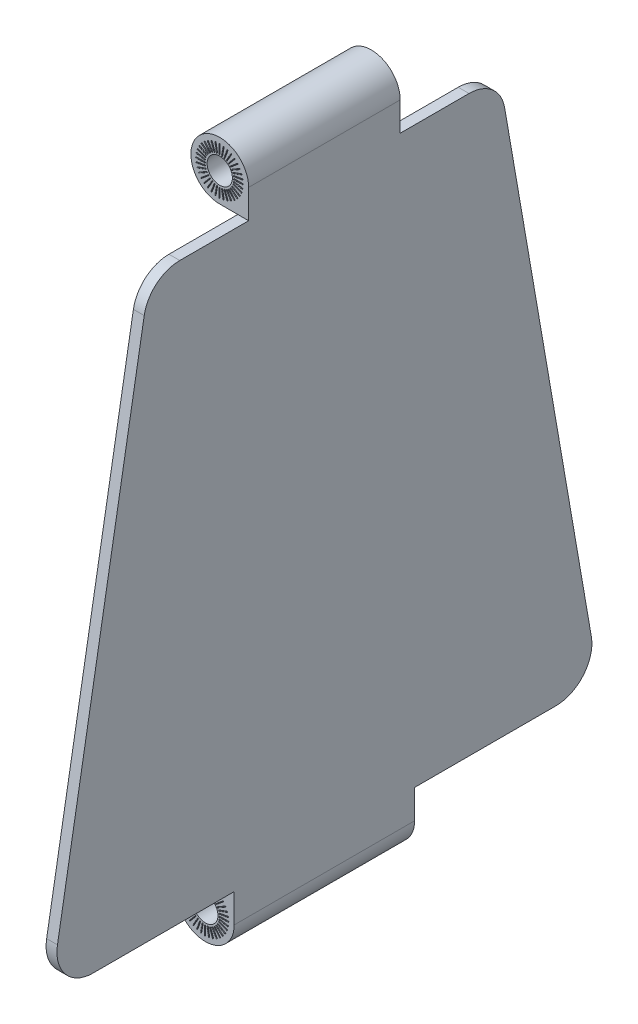
from build123d import *

# Parameters (mm, degrees)
BOSS_EXTRUDE1_DEPTH      = 76
BOSS_EXTRUDE1_DEPTH_BACK = 76
SKETCH1_R                = 8
SKETCH2_W                = 174.348396913
SKETCH2_H                = 36.623330016
SKETCH2_W_2              = 158.861261105
SKETCH2_H_2              = 40.351297492
CUT_EXTRUDE1_DEPTH       = 199.798893357
SKETCH3_W                = 238.196848014
SKETCH3_H                = 22.562128098
SKETCH3_W_2              = 145.719761373
CUT_EXTRUDE2_DEPTH       = 199.798893357
CUT_EXTRUDE3_DEPTH       = 199.798893357
FILLET1_R                = 10
FILLET2_R                = 10
CUT_EXTRUDE4_DEPTH       = 199.088533134
CUT_EXTRUDE4_DEPTH_BACK  = 199.088533134
SKETCH6_R                = 3.5
SKETCH7_W                = 0.2
SKETCH7_H                = 2.5
BOSS_EXTRUDE2_DEPTH      = 21.2
FILLET3_R                = 0.1
CIRPATTERN2_COUNT        = 36
FILLET3_OF_CIRPATTERN2_R = 0.1
SKETCH8_W                = 0.2
SKETCH8_H                = 2.5
BOSS_EXTRUDE3_DEPTH      = 25.2
FILLET4_R                = 0.1
CIRPATTERN9_START        = -6.5
CIRPATTERN9_DEPTH        = 2.5
CIRPATTERN9_START_2      = -14.5
CIRPATTERN9_2_DEPTH      = 2.5
CIRPATTERN9_START_3      = -4
CIRPATTERN9_3_DEPTH      = 2.5
CIRPATTERN9_START_4      = -7.889185421
CIRPATTERN9_4_DEPTH      = 2.5
CIRPATTERN9_START_5      = 2.610814579
CIRPATTERN9_5_DEPTH      = 2.5
CIRPATTERN9_START_6      = -9.236161147
CIRPATTERN9_6_DEPTH      = 2.5
CIRPATTERN9_START_7      = 1.263838853
CIRPATTERN9_7_DEPTH      = 2.5
CIRPATTERN9_START_8      = -10.5
CIRPATTERN9_8_DEPTH      = 2.5
CIRPATTERN9_9_DEPTH      = 2.5
CIRPATTERN9_START_9      = -11.642300877
CIRPATTERN9_10_DEPTH     = 2.5
CIRPATTERN9_START_10     = -1.142300877
CIRPATTERN9_11_DEPTH     = 2.5
CIRPATTERN9_START_11     = -12.628355545
CIRPATTERN9_12_DEPTH     = 2.5
CIRPATTERN9_START_12     = -2.128355545
CIRPATTERN9_13_DEPTH     = 2.5
CIRPATTERN9_START_13     = -13.42820323
CIRPATTERN9_14_DEPTH     = 2.5
CIRPATTERN9_START_14     = -2.92820323
CIRPATTERN9_15_DEPTH     = 2.5
CIRPATTERN9_START_15     = -14.017540966
CIRPATTERN9_16_DEPTH     = 2.5
CIRPATTERN9_START_16     = -3.517540966
CIRPATTERN9_17_DEPTH     = 2.5
CIRPATTERN9_START_17     = -14.378462024
CIRPATTERN9_18_DEPTH     = 2.5
CIRPATTERN9_START_18     = -3.878462024
CIRPATTERN9_19_DEPTH     = 2.5
CIRPATTERN9_20_DEPTH     = 2.5
CIRPATTERN9_21_DEPTH     = 2.5
CIRPATTERN9_22_DEPTH     = 2.5
CIRPATTERN9_23_DEPTH     = 2.5
CIRPATTERN9_24_DEPTH     = 2.5
CIRPATTERN9_25_DEPTH     = 2.5
CIRPATTERN9_26_DEPTH     = 2.5
CIRPATTERN9_27_DEPTH     = 2.5
CIRPATTERN9_28_DEPTH     = 2.5
CIRPATTERN9_29_DEPTH     = 2.5
CIRPATTERN9_30_DEPTH     = 2.5
CIRPATTERN9_31_DEPTH     = 2.5
CIRPATTERN9_32_DEPTH     = 2.5
CIRPATTERN9_33_DEPTH     = 2.5
CIRPATTERN9_34_DEPTH     = 2.5
CIRPATTERN9_35_DEPTH     = 2.5


with BuildPart() as part:
    # Sketch1 → Boss-Extrude1 (new, two sides: drawn at the far end of the back side and taken through both)
    with BuildSketch(Plane.XY.offset(-BOSS_EXTRUDE1_DEPTH_BACK)):
        with Locations((-8, 175)):
            Circle(SKETCH1_R)
        with BuildLine():
            ThreePointArc((-3, 168.755002002), (-5.350470229, 167.451490744), (-8, 167))
            Line((-8, 167), (-3, 167))
            Line((-3, 167), (-3, 168.755002002))
        make_face()
        with BuildLine():
            ThreePointArc((-3, 6.244997998), (-0.788897449, 3.464101615), (0, 0))
            Line((0, 0), (0, 175))
            ThreePointArc((0, 175), (-0.788897449, 171.535898385), (-3, 168.755002002))
            Line((-3, 168.755002002), (-3, 167))
            Line((-3, 167), (-3, 8))
            Line((-3, 8), (-3, 6.244997998))
        make_face()
        with BuildLine():
            ThreePointArc((-8, 8), (-5.350470229, 7.548509256), (-3, 6.244997998))
            Line((-3, 6.244997998), (-3, 8))
            Line((-3, 8), (-8, 8))
        make_face()
        with Locations((-8, 0)):
            Circle(SKETCH1_R)
    extrude(amount=BOSS_EXTRUDE1_DEPTH + BOSS_EXTRUDE1_DEPTH_BACK)

    # Sketch2 → Cut-Extrude1 (cut, through all)
    with BuildSketch(Plane(origin=(0, 0, 0), x_dir=(0, 0, -1), z_dir=(1, 0, 0))):
        with Locations((108.174198457, 185.311665008)):
            Rectangle(SKETCH2_W, SKETCH2_H)
        with Locations((-100.430630553, 187.175648746)):
            Rectangle(SKETCH2_W_2, SKETCH2_H_2)
    extrude(amount=-CUT_EXTRUDE1_DEPTH, mode=Mode.SUBTRACT)

    # Sketch3 → Cut-Extrude2 (cut, through all)
    with BuildSketch(Plane(origin=(0, 0, 0), x_dir=(0, 0, -1), z_dir=(1, 0, 0))):
        with Locations((-144.098424007, -3.281064049)):
            Rectangle(SKETCH3_W, SKETCH3_H)
        with Locations((97.859880687, -3.281064049)):
            Rectangle(SKETCH3_W_2, SKETCH3_H)
    extrude(amount=-CUT_EXTRUDE2_DEPTH, mode=Mode.SUBTRACT)

    # Sketch4 → Cut-Extrude3 (cut, through all)
    with BuildSketch(Plane(origin=(0, 0, 0), x_dir=(0, 0, -1), z_dir=(1, 0, 0))):
        Polygon((48.5, 167), (48.5, 180.668387229), (93.570436927, 180.668387229), (93.570436927, 2.807353777), (76, 2.807353777), (76, 8), align=None)
        Polygon((-48.5, 167), (-76, 8), (-76, 0), (-100.934074168, 0), (-100.934074168, 184.48155451), (-48.5, 184.48155451), align=None)
    extrude(amount=-CUT_EXTRUDE3_DEPTH, mode=Mode.SUBTRACT)

    # Fillet1
    fillet1_edges = [part.edges().sort_by_distance(p)[0] for p in [
        (-1.5, 167, -48.5),
        (-1.5, 167, 48.5),
    ]]
    fillet(fillet1_edges, radius=FILLET1_R)

    # Fillet2
    fillet2_edges = [part.edges().sort_by_distance(p)[0] for p in [
        (-1.5, 8, 76),
        (-1.5, 8, -76),
    ]]
    fillet(fillet2_edges, radius=FILLET2_R)

    # Sketch6 → Cut-Extrude4 (cut, two sides: drawn at the far end of the back side and taken through both)
    with BuildSketch(Plane.XY.offset(-CUT_EXTRUDE4_DEPTH_BACK)):
        with Locations((-8, 175)):
            Circle(SKETCH6_R)
        with Locations(Location((-8, 0, 0), (0, 0, 90))):
            Circle(SKETCH6_R)
    extrude(amount=CUT_EXTRUDE4_DEPTH + CUT_EXTRUDE4_DEPTH_BACK, mode=Mode.SUBTRACT)

    # Sketch7 → Boss-Extrude2 (add, symmetric)
    with BuildSketch(Plane.XY):
        with Locations((-8, 180.25)):
            Rectangle(SKETCH7_W, SKETCH7_H)
    boss_extrude2 = extrude(amount=BOSS_EXTRUDE2_DEPTH, both=True)

    # Fillet3
    fillet3_edges = [part.edges().sort_by_distance(p)[0] for p in [
        (-8.1, 180.25, 21.2),
        (-7.9, 180.25, 21.2),
        (-8.1, 180.25, -21.2),
        (-7.9, 180.25, -21.2),
    ]]
    fillet(fillet3_edges, radius=FILLET3_R - 0.0001)  # a hair under: the kernel refuses the full size

    # CirPattern2: Boss-Extrude2 ×36 about axis
    cirpattern2_axis = Axis((-8, 175, 0), (0, 0, 1))
    for i in range(1, CIRPATTERN2_COUNT):
        add(boss_extrude2.rotate(cirpattern2_axis, i * 360 / CIRPATTERN2_COUNT))

    # Fillet3 of CirPattern2
    fillet3_of_cirpattern2_edges = [part.edges().sort_by_distance(p)[0] for p in [
        (-9.010133708, 180.152875886, 21.2),
        (-8.813172157, 180.187605521, 21.2),
        (-9.010133708, 180.152875886, -21.2),
        (-8.813172157, 180.187605521, -21.2),
        (-9.889575015, 179.899184245, 21.2),
        (-9.70163649, 179.967588273, 21.2),
        (-9.889575015, 179.899184245, -21.2),
        (-9.70163649, 179.967588273, -21.2),
        (-10.71160254, 179.49663337, 21.2),
        (-10.53839746, 179.59663337, 21.2),
        (-10.71160254, 179.49663337, -21.2),
        (-10.53839746, 179.59663337, -21.2),
        (-11.451239395, 178.957454565, 21.2),
        (-11.298030507, 179.086012087, 21.2),
        (-11.451239395, 178.957454565, -21.2),
        (-11.298030507, 179.086012087, -21.2),
        (-12.086012087, 178.298030507, 21.2),
        (-11.957454565, 178.451239395, 21.2),
        (-12.086012087, 178.298030507, -21.2),
        (-11.957454565, 178.451239395, -21.2),
        (-12.59663337, 177.53839746, 21.2),
        (-12.49663337, 177.71160254, 21.2),
        (-12.59663337, 177.53839746, -21.2),
        (-12.49663337, 177.71160254, -21.2),
        (-12.967588273, 176.70163649, 21.2),
        (-12.899184245, 176.889575015, 21.2),
        (-12.967588273, 176.70163649, -21.2),
        (-12.899184245, 176.889575015, -21.2),
        (-13.187605521, 175.813172157, 21.2),
        (-13.152875886, 176.010133708, 21.2),
        (-13.187605521, 175.813172157, -21.2),
        (-13.152875886, 176.010133708, -21.2),
        (-13.25, 174.9, 21.2),
        (-13.25, 175.1, 21.2),
        (-13.25, 174.9, -21.2),
        (-13.25, 175.1, -21.2),
        (-13.152875886, 173.989866292, 21.2),
        (-13.187605521, 174.186827843, 21.2),
        (-13.152875886, 173.989866292, -21.2),
        (-13.187605521, 174.186827843, -21.2),
        (-12.899184245, 173.110424985, 21.2),
        (-12.967588273, 173.29836351, 21.2),
        (-12.899184245, 173.110424985, -21.2),
        (-12.967588273, 173.29836351, -21.2),
        (-12.49663337, 172.28839746, 21.2),
        (-12.59663337, 172.46160254, 21.2),
        (-12.49663337, 172.28839746, -21.2),
        (-12.59663337, 172.46160254, -21.2),
        (-11.957454565, 171.548760605, 21.2),
        (-12.086012087, 171.701969493, 21.2),
        (-11.957454565, 171.548760605, -21.2),
        (-12.086012087, 171.701969493, -21.2),
        (-11.298030507, 170.913987913, 21.2),
        (-11.451239395, 171.042545435, 21.2),
        (-11.298030507, 170.913987913, -21.2),
        (-11.451239395, 171.042545435, -21.2),
        (-10.53839746, 170.40336663, 21.2),
        (-10.71160254, 170.50336663, 21.2),
        (-10.53839746, 170.40336663, -21.2),
        (-10.71160254, 170.50336663, -21.2),
        (-9.70163649, 170.032411727, 21.2),
        (-9.889575015, 170.100815755, 21.2),
        (-9.70163649, 170.032411727, -21.2),
        (-9.889575015, 170.100815755, -21.2),
        (-8.813172157, 169.812394479, 21.2),
        (-9.010133708, 169.847124114, 21.2),
        (-8.813172157, 169.812394479, -21.2),
        (-9.010133708, 169.847124114, -21.2),
        (-7.9, 169.75, 21.2),
        (-8.1, 169.75, 21.2),
        (-7.9, 169.75, -21.2),
        (-8.1, 169.75, -21.2),
        (-6.989866292, 169.847124114, 21.2),
        (-7.186827843, 169.812394479, 21.2),
        (-6.989866292, 169.847124114, -21.2),
        (-7.186827843, 169.812394479, -21.2),
        (-6.110424985, 170.100815755, 21.2),
        (-6.29836351, 170.032411727, 21.2),
        (-6.110424985, 170.100815755, -21.2),
        (-6.29836351, 170.032411727, -21.2),
        (-5.28839746, 170.50336663, 21.2),
        (-5.46160254, 170.40336663, 21.2),
        (-5.28839746, 170.50336663, -21.2),
        (-5.46160254, 170.40336663, -21.2),
        (-4.548760605, 171.042545435, 21.2),
        (-4.701969493, 170.913987913, 21.2),
        (-4.548760605, 171.042545435, -21.2),
        (-4.701969493, 170.913987913, -21.2),
        (-3.913987913, 171.701969493, 21.2),
        (-4.042545435, 171.548760605, 21.2),
        (-3.913987913, 171.701969493, -21.2),
        (-4.042545435, 171.548760605, -21.2),
        (-3.40336663, 172.46160254, 21.2),
        (-3.50336663, 172.28839746, 21.2),
        (-3.40336663, 172.46160254, -21.2),
        (-3.50336663, 172.28839746, -21.2),
        (-3.032411727, 173.29836351, 21.2),
        (-3.100815755, 173.110424985, 21.2),
        (-3.032411727, 173.29836351, -21.2),
        (-3.100815755, 173.110424985, -21.2),
        (-2.812394479, 174.186827843, 21.2),
        (-2.847124114, 173.989866292, 21.2),
        (-2.812394479, 174.186827843, -21.2),
        (-2.847124114, 173.989866292, -21.2),
        (-2.75, 175.1, 21.2),
        (-2.75, 174.9, 21.2),
        (-2.75, 175.1, -21.2),
        (-2.75, 174.9, -21.2),
        (-2.847124114, 176.010133708, 21.2),
        (-2.812394479, 175.813172157, 21.2),
        (-2.847124114, 176.010133708, -21.2),
        (-2.812394479, 175.813172157, -21.2),
        (-3.100815755, 176.889575015, 21.2),
        (-3.032411727, 176.70163649, 21.2),
        (-3.100815755, 176.889575015, -21.2),
        (-3.032411727, 176.70163649, -21.2),
        (-3.50336663, 177.71160254, 21.2),
        (-3.40336663, 177.53839746, 21.2),
        (-3.50336663, 177.71160254, -21.2),
        (-3.40336663, 177.53839746, -21.2),
        (-4.042545435, 178.451239395, 21.2),
        (-3.913987913, 178.298030507, 21.2),
        (-4.042545435, 178.451239395, -21.2),
        (-3.913987913, 178.298030507, -21.2),
        (-4.701969493, 179.086012087, 21.2),
        (-4.548760605, 178.957454565, 21.2),
        (-4.701969493, 179.086012087, -21.2),
        (-4.548760605, 178.957454565, -21.2),
        (-5.46160254, 179.59663337, 21.2),
        (-5.28839746, 179.49663337, 21.2),
        (-5.46160254, 179.59663337, -21.2),
        (-5.28839746, 179.49663337, -21.2),
        (-6.29836351, 179.967588273, 21.2),
        (-6.110424985, 179.899184245, 21.2),
        (-6.29836351, 179.967588273, -21.2),
        (-6.110424985, 179.899184245, -21.2),
        (-7.186827843, 180.187605521, 21.2),
        (-6.989866292, 180.152875886, 21.2),
        (-7.186827843, 180.187605521, -21.2),
        (-6.989866292, 180.152875886, -21.2),
    ]]
    fillet(fillet3_of_cirpattern2_edges, radius=FILLET3_OF_CIRPATTERN2_R - 0.0001)  # a hair under: the kernel refuses the full size

    # Sketch8 → Boss-Extrude3 (add, symmetric)
    with BuildSketch(Plane.XY):
        with Locations((-8, 5.25)):
            Rectangle(SKETCH8_W, SKETCH8_H)
    extrude(amount=BOSS_EXTRUDE3_DEPTH, both=True)

    # Fillet4
    fillet4_edges = [part.edges().sort_by_distance(p)[0] for p in [
        (-8.1, 5.25, 25.2),
        (-7.9, 5.25, 25.2),
        (-8.1, 5.25, -25.2),
        (-7.9, 5.25, -25.2),
    ]]
    fillet(fillet4_edges, radius=FILLET4_R - 0.0001)  # a hair under: the kernel refuses the full size

    # CirPattern9: read off the stored shape, not the designer's step
    # CirPattern9 outline → CirPattern9 (add)
    with BuildSketch(Plane(origin=(0, 0, 0), x_dir=(1, 0, 0), z_dir=(0, 1, 0)).offset(CIRPATTERN9_START)):
        with BuildLine():
            Line((-8.1, 25.1), (-8.1, 25))
            Line((-8.1, 25), (-7.9, 25))
            Line((-7.9, 25), (-7.9, 25.1))
            ThreePointArc((-7.9, 25.1), (-7.929289322, 25.170710678), (-8, 25.2))
            ThreePointArc((-8, 25.2), (-8.070710678, 25.170710678), (-8.1, 25.1))
        make_face()
        with BuildLine():
            Line((-8.1, -25), (-8.1, -25.1))
            ThreePointArc((-8.1, -25.1), (-8.070710678, -25.170710678), (-8, -25.2))
            ThreePointArc((-8, -25.2), (-7.929289322, -25.170710678), (-7.9, -25.1))
            Line((-7.9, -25.1), (-7.9, -25))
            Line((-7.9, -25), (-8.1, -25))
        make_face()
    extrude(amount=CIRPATTERN9_DEPTH)

    # CirPattern9 2 outline → CirPattern9 2 (add)
    with BuildSketch(Plane.YZ.offset(CIRPATTERN9_START_2)):
        with BuildLine():
            Line((-0.1, -25), (-0.1, -25.1))
            ThreePointArc((-0.1, -25.1), (-0.070710678, -25.170710678), (0, -25.2))
            ThreePointArc((0, -25.2), (0.070710678, -25.170710678), (0.1, -25.1))
            Line((0.1, -25.1), (0.1, -25))
            Line((0.1, -25), (-0.1, -25))
        make_face()
        with BuildLine():
            Line((-0.1, 25.1), (-0.1, 25))
            Line((-0.1, 25), (0.1, 25))
            Line((0.1, 25), (0.1, 25.1))
            ThreePointArc((0.1, 25.1), (0.070710678, 25.170710678), (0, 25.2))
            ThreePointArc((0, 25.2), (-0.070710678, 25.170710678), (-0.1, 25.1))
        make_face()
    extrude(amount=CIRPATTERN9_2_DEPTH)

    # CirPattern9 3 outline → CirPattern9 3 (add)
    with BuildSketch(Plane.YZ.offset(CIRPATTERN9_START_3)):
        with BuildLine():
            Line((-0.1, -25), (-0.1, -25.1))
            ThreePointArc((-0.1, -25.1), (-0.070710678, -25.170710678), (0, -25.2))
            ThreePointArc((0, -25.2), (0.070710678, -25.170710678), (0.1, -25.1))
            Line((0.1, -25.1), (0.1, -25))
            Line((0.1, -25), (-0.1, -25))
        make_face()
        with BuildLine():
            Line((-0.1, 25.1), (-0.1, 25))
            Line((-0.1, 25), (0.1, 25))
            Line((0.1, 25), (0.1, 25.1))
            ThreePointArc((0.1, 25.1), (0.070710678, 25.170710678), (0, 25.2))
            ThreePointArc((0, 25.2), (-0.070710678, 25.170710678), (-0.1, 25.1))
        make_face()
    extrude(amount=CIRPATTERN9_3_DEPTH)

    # CirPattern9 4 outline → CirPattern9 4 (add)
    with BuildSketch(Plane(origin=(0, 0, 0), x_dir=(0.9848077530122084, -0.17364817766692905, 0), z_dir=(0.17364817766692905, 0.9848077530122084, 0)).offset(CIRPATTERN9_START_4)):
        with BuildLine():
            Line((-7.778462024, 25), (-7.778462024, 25.1))
            ThreePointArc((-7.778462024, 25.1), (-7.807751346, 25.170710678), (-7.878462024, 25.2))
            ThreePointArc((-7.878462024, 25.2), (-7.949172702, 25.170710678), (-7.978462024, 25.1))
            Line((-7.978462024, 25.1), (-7.978462024, 25))
            Line((-7.978462024, 25), (-7.778462024, 25))
        make_face()
        with BuildLine():
            Line((-7.778462024, -25.1), (-7.778462024, -25))
            Line((-7.778462024, -25), (-7.978462024, -25))
            Line((-7.978462024, -25), (-7.978462024, -25.1))
            ThreePointArc((-7.978462024, -25.1), (-7.949172702, -25.170710678), (-7.878462024, -25.2))
            ThreePointArc((-7.878462024, -25.2), (-7.807751346, -25.170710678), (-7.778462024, -25.1))
        make_face()
    extrude(amount=CIRPATTERN9_4_DEPTH)

    # CirPattern9 5 outline → CirPattern9 5 (add)
    with BuildSketch(Plane(origin=(0, 0, 0), x_dir=(0.9848077530122084, -0.17364817766692905, 0), z_dir=(0.17364817766692905, 0.9848077530122084, 0)).offset(CIRPATTERN9_START_5)):
        with BuildLine():
            Line((-7.778462024, 25), (-7.778462024, 25.1))
            ThreePointArc((-7.778462024, 25.1), (-7.807751346, 25.170710678), (-7.878462024, 25.2))
            ThreePointArc((-7.878462024, 25.2), (-7.949172702, 25.170710678), (-7.978462024, 25.1))
            Line((-7.978462024, 25.1), (-7.978462024, 25))
            Line((-7.978462024, 25), (-7.778462024, 25))
        make_face()
        with BuildLine():
            Line((-7.778462024, -25.1), (-7.778462024, -25))
            Line((-7.778462024, -25), (-7.978462024, -25))
            Line((-7.978462024, -25), (-7.978462024, -25.1))
            ThreePointArc((-7.978462024, -25.1), (-7.949172702, -25.170710678), (-7.878462024, -25.2))
            ThreePointArc((-7.878462024, -25.2), (-7.807751346, -25.170710678), (-7.778462024, -25.1))
        make_face()
    extrude(amount=CIRPATTERN9_5_DEPTH)

    # CirPattern9 6 outline → CirPattern9 6 (add)
    with BuildSketch(Plane(origin=(0, 0, 0), x_dir=(0.9396926207859088, -0.34202014332566794, 0), z_dir=(0.34202014332566794, 0.9396926207859088, 0)).offset(CIRPATTERN9_START_6)):
        with BuildLine():
            Line((-7.417540966, 25), (-7.417540966, 25.1))
            ThreePointArc((-7.417540966, 25.1), (-7.446830288, 25.170710678), (-7.517540966, 25.2))
            ThreePointArc((-7.517540966, 25.2), (-7.588251644, 25.170710678), (-7.617540966, 25.1))
            Line((-7.617540966, 25.1), (-7.617540966, 25))
            Line((-7.617540966, 25), (-7.417540966, 25))
        make_face()
        with BuildLine():
            Line((-7.417540966, -25.1), (-7.417540966, -25))
            Line((-7.417540966, -25), (-7.617540966, -25))
            Line((-7.617540966, -25), (-7.617540966, -25.1))
            ThreePointArc((-7.617540966, -25.1), (-7.588251644, -25.170710678), (-7.517540966, -25.2))
            ThreePointArc((-7.517540966, -25.2), (-7.446830288, -25.170710678), (-7.417540966, -25.1))
        make_face()
    extrude(amount=CIRPATTERN9_6_DEPTH)

    # CirPattern9 7 outline → CirPattern9 7 (add)
    with BuildSketch(Plane(origin=(0, 0, 0), x_dir=(0.9396926207859088, -0.34202014332566794, 0), z_dir=(0.34202014332566794, 0.9396926207859088, 0)).offset(CIRPATTERN9_START_7)):
        with BuildLine():
            Line((-7.417540966, 25), (-7.417540966, 25.1))
            ThreePointArc((-7.417540966, 25.1), (-7.446830288, 25.170710678), (-7.517540966, 25.2))
            ThreePointArc((-7.517540966, 25.2), (-7.588251644, 25.170710678), (-7.617540966, 25.1))
            Line((-7.617540966, 25.1), (-7.617540966, 25))
            Line((-7.617540966, 25), (-7.417540966, 25))
        make_face()
        with BuildLine():
            Line((-7.417540966, -25.1), (-7.417540966, -25))
            Line((-7.417540966, -25), (-7.617540966, -25))
            Line((-7.617540966, -25), (-7.617540966, -25.1))
            ThreePointArc((-7.617540966, -25.1), (-7.588251644, -25.170710678), (-7.517540966, -25.2))
            ThreePointArc((-7.517540966, -25.2), (-7.446830288, -25.170710678), (-7.417540966, -25.1))
        make_face()
    extrude(amount=CIRPATTERN9_7_DEPTH)

    # CirPattern9 8 outline → CirPattern9 8 (add)
    with BuildSketch(Plane(origin=(0, 0, 0), x_dir=(0.8660254037844386, -0.4999999999999999, 0), z_dir=(0.4999999999999999, 0.8660254037844388, 0)).offset(CIRPATTERN9_START_8)):
        with BuildLine():
            Line((-6.82820323, 25), (-6.82820323, 25.1))
            ThreePointArc((-6.82820323, 25.1), (-6.857492552, 25.170710678), (-6.92820323, 25.2))
            ThreePointArc((-6.92820323, 25.2), (-6.998913908, 25.170710678), (-7.02820323, 25.1))
            Line((-7.02820323, 25.1), (-7.02820323, 25))
            Line((-7.02820323, 25), (-6.82820323, 25))
        make_face()
        with BuildLine():
            Line((-6.82820323, -25.1), (-6.82820323, -25))
            Line((-6.82820323, -25), (-7.02820323, -25))
            Line((-7.02820323, -25), (-7.02820323, -25.1))
            ThreePointArc((-7.02820323, -25.1), (-6.998913908, -25.170710678), (-6.92820323, -25.2))
            ThreePointArc((-6.92820323, -25.2), (-6.857492552, -25.170710678), (-6.82820323, -25.1))
        make_face()
    extrude(amount=CIRPATTERN9_8_DEPTH)

    # CirPattern9 9 outline → CirPattern9 9 (add)
    with BuildSketch(Plane(origin=(0, 0, 0), x_dir=(0.8660254037844386, -0.4999999999999999, 0), z_dir=(0.4999999999999999, 0.8660254037844388, 0))):
        with BuildLine():
            Line((-6.82820323, 25), (-6.82820323, 25.1))
            ThreePointArc((-6.82820323, 25.1), (-6.857492552, 25.170710678), (-6.92820323, 25.2))
            ThreePointArc((-6.92820323, 25.2), (-6.998913908, 25.170710678), (-7.02820323, 25.1))
            Line((-7.02820323, 25.1), (-7.02820323, 25))
            Line((-7.02820323, 25), (-6.82820323, 25))
        make_face()
        with BuildLine():
            Line((-6.82820323, -25.1), (-6.82820323, -25))
            Line((-6.82820323, -25), (-7.02820323, -25))
            Line((-7.02820323, -25), (-7.02820323, -25.1))
            ThreePointArc((-7.02820323, -25.1), (-6.998913908, -25.170710678), (-6.92820323, -25.2))
            ThreePointArc((-6.92820323, -25.2), (-6.857492552, -25.170710678), (-6.82820323, -25.1))
        make_face()
    extrude(amount=CIRPATTERN9_9_DEPTH)

    # CirPattern9 10 outline → CirPattern9 10 (add)
    with BuildSketch(Plane(origin=(0, 0, 0), x_dir=(0.7660444431189782, -0.6427876096865391, 0), z_dir=(0.6427876096865391, 0.7660444431189782, 0)).offset(CIRPATTERN9_START_9)):
        with BuildLine():
            Line((-6.028355545, 25), (-6.028355545, 25.1))
            ThreePointArc((-6.028355545, 25.1), (-6.057644867, 25.170710678), (-6.128355545, 25.2))
            ThreePointArc((-6.128355545, 25.2), (-6.199066223, 25.170710678), (-6.228355545, 25.1))
            Line((-6.228355545, 25.1), (-6.228355545, 25))
            Line((-6.228355545, 25), (-6.028355545, 25))
        make_face()
        with BuildLine():
            Line((-6.028355545, -25.1), (-6.028355545, -25))
            Line((-6.028355545, -25), (-6.228355545, -25))
            Line((-6.228355545, -25), (-6.228355545, -25.1))
            ThreePointArc((-6.228355545, -25.1), (-6.199066223, -25.170710678), (-6.128355545, -25.2))
            ThreePointArc((-6.128355545, -25.2), (-6.057644867, -25.170710678), (-6.028355545, -25.1))
        make_face()
    extrude(amount=CIRPATTERN9_10_DEPTH)

    # CirPattern9 11 outline → CirPattern9 11 (add)
    with BuildSketch(Plane(origin=(0, 0, 0), x_dir=(0.7660444431189782, -0.6427876096865391, 0), z_dir=(0.6427876096865391, 0.7660444431189782, 0)).offset(CIRPATTERN9_START_10)):
        with BuildLine():
            Line((-6.028355545, 25), (-6.028355545, 25.1))
            ThreePointArc((-6.028355545, 25.1), (-6.057644867, 25.170710678), (-6.128355545, 25.2))
            ThreePointArc((-6.128355545, 25.2), (-6.199066223, 25.170710678), (-6.228355545, 25.1))
            Line((-6.228355545, 25.1), (-6.228355545, 25))
            Line((-6.228355545, 25), (-6.028355545, 25))
        make_face()
        with BuildLine():
            Line((-6.028355545, -25.1), (-6.028355545, -25))
            Line((-6.028355545, -25), (-6.228355545, -25))
            Line((-6.228355545, -25), (-6.228355545, -25.1))
            ThreePointArc((-6.228355545, -25.1), (-6.199066223, -25.170710678), (-6.128355545, -25.2))
            ThreePointArc((-6.128355545, -25.2), (-6.057644867, -25.170710678), (-6.028355545, -25.1))
        make_face()
    extrude(amount=CIRPATTERN9_11_DEPTH)

    # CirPattern9 12 outline → CirPattern9 12 (add)
    with BuildSketch(Plane(origin=(0, 0, 0), x_dir=(0.642787609686539, -0.7660444431189782, 0), z_dir=(0.7660444431189782, 0.6427876096865391, 0)).offset(CIRPATTERN9_START_11)):
        with BuildLine():
            Line((-5.042300877, 25), (-5.042300877, 25.1))
            ThreePointArc((-5.042300877, 25.1), (-5.071590199, 25.170710678), (-5.142300877, 25.2))
            ThreePointArc((-5.142300877, 25.2), (-5.213011555, 25.170710679), (-5.242300877, 25.1))
            Line((-5.242300877, 25.1), (-5.242300877, 25))
            Line((-5.242300877, 25), (-5.042300877, 25))
        make_face()
        with BuildLine():
            Line((-5.042300877, -25.1), (-5.042300877, -25))
            Line((-5.042300877, -25), (-5.242300877, -25))
            Line((-5.242300877, -25), (-5.242300877, -25.1))
            ThreePointArc((-5.242300877, -25.1), (-5.213011555, -25.170710679), (-5.142300877, -25.2))
            ThreePointArc((-5.142300877, -25.2), (-5.071590199, -25.170710678), (-5.042300877, -25.1))
        make_face()
    extrude(amount=CIRPATTERN9_12_DEPTH)

    # CirPattern9 13 outline → CirPattern9 13 (add)
    with BuildSketch(Plane(origin=(0, 0, 0), x_dir=(0.642787609686539, -0.7660444431189782, 0), z_dir=(0.7660444431189782, 0.6427876096865391, 0)).offset(CIRPATTERN9_START_12)):
        with BuildLine():
            Line((-5.042300877, 25), (-5.042300877, 25.1))
            ThreePointArc((-5.042300877, 25.1), (-5.071590199, 25.170710678), (-5.142300877, 25.2))
            ThreePointArc((-5.142300877, 25.2), (-5.213011555, 25.170710679), (-5.242300877, 25.1))
            Line((-5.242300877, 25.1), (-5.242300877, 25))
            Line((-5.242300877, 25), (-5.042300877, 25))
        make_face()
        with BuildLine():
            Line((-5.042300877, -25.1), (-5.042300877, -25))
            Line((-5.042300877, -25), (-5.242300877, -25))
            Line((-5.242300877, -25), (-5.242300877, -25.1))
            ThreePointArc((-5.242300877, -25.1), (-5.213011555, -25.170710679), (-5.142300877, -25.2))
            ThreePointArc((-5.142300877, -25.2), (-5.071590199, -25.170710678), (-5.042300877, -25.1))
        make_face()
    extrude(amount=CIRPATTERN9_13_DEPTH)

    # CirPattern9 14 outline → CirPattern9 14 (add)
    with BuildSketch(Plane(origin=(0, 0, 0), x_dir=(0.4999999999999988, -0.8660254037844395, 0), z_dir=(0.8660254037844393, 0.4999999999999991, 0)).offset(CIRPATTERN9_START_13)):
        with BuildLine():
            Line((-3.9, 25), (-3.9, 25.1))
            ThreePointArc((-3.9, 25.1), (-3.929289322, 25.170710678), (-4, 25.2))
            ThreePointArc((-4, 25.2), (-4.070710678, 25.170710678), (-4.1, 25.1))
            Line((-4.1, 25.1), (-4.1, 25))
            Line((-4.1, 25), (-3.9, 25))
        make_face()
        with BuildLine():
            Line((-3.9, -25.1), (-3.9, -25))
            Line((-3.9, -25), (-4.1, -25))
            Line((-4.1, -25), (-4.1, -25.1))
            ThreePointArc((-4.1, -25.1), (-4.070710678, -25.170710678), (-4, -25.2))
            ThreePointArc((-4, -25.2), (-3.929289322, -25.170710678), (-3.9, -25.1))
        make_face()
    extrude(amount=CIRPATTERN9_14_DEPTH)

    # CirPattern9 15 outline → CirPattern9 15 (add)
    with BuildSketch(Plane(origin=(0, 0, 0), x_dir=(0.4999999999999988, -0.8660254037844395, 0), z_dir=(0.8660254037844393, 0.4999999999999991, 0)).offset(CIRPATTERN9_START_14)):
        with BuildLine():
            Line((-3.9, 25), (-3.9, 25.1))
            ThreePointArc((-3.9, 25.1), (-3.929289322, 25.170710678), (-4, 25.2))
            ThreePointArc((-4, 25.2), (-4.070710678, 25.170710678), (-4.1, 25.1))
            Line((-4.1, 25.1), (-4.1, 25))
            Line((-4.1, 25), (-3.9, 25))
        make_face()
        with BuildLine():
            Line((-3.9, -25.1), (-3.9, -25))
            Line((-3.9, -25), (-4.1, -25))
            Line((-4.1, -25), (-4.1, -25.1))
            ThreePointArc((-4.1, -25.1), (-4.070710678, -25.170710678), (-4, -25.2))
            ThreePointArc((-4, -25.2), (-3.929289322, -25.170710678), (-3.9, -25.1))
        make_face()
    extrude(amount=CIRPATTERN9_15_DEPTH)

    # CirPattern9 16 outline → CirPattern9 16 (add)
    with BuildSketch(Plane(origin=(0, 0, 0), x_dir=(-0.34202014332566794, 0.9396926207859088, 0), z_dir=(0.9396926207859088, 0.34202014332566794, 0)).offset(CIRPATTERN9_START_15)):
        with BuildLine():
            Line((2.636161147, -25), (2.636161147, -25.1))
            ThreePointArc((2.636161147, -25.1), (2.665450469, -25.170710679), (2.736161147, -25.2))
            ThreePointArc((2.736161147, -25.2), (2.806871825, -25.170710678), (2.836161147, -25.1))
            Line((2.836161147, -25.1), (2.836161147, -25))
            Line((2.836161147, -25), (2.636161147, -25))
        make_face()
        with BuildLine():
            Line((2.636161147, 25.1), (2.636161147, 25))
            Line((2.636161147, 25), (2.836161147, 25))
            Line((2.836161147, 25), (2.836161147, 25.1))
            ThreePointArc((2.836161147, 25.1), (2.806871825, 25.170710678), (2.736161147, 25.2))
            ThreePointArc((2.736161147, 25.2), (2.665450469, 25.170710679), (2.636161147, 25.1))
        make_face()
    extrude(amount=CIRPATTERN9_16_DEPTH)

    # CirPattern9 17 outline → CirPattern9 17 (add)
    with BuildSketch(Plane(origin=(0, 0, 0), x_dir=(-0.34202014332566794, 0.9396926207859088, 0), z_dir=(0.9396926207859088, 0.34202014332566794, 0)).offset(CIRPATTERN9_START_16)):
        with BuildLine():
            Line((2.636161147, -25), (2.636161147, -25.1))
            ThreePointArc((2.636161147, -25.1), (2.665450469, -25.170710679), (2.736161147, -25.2))
            ThreePointArc((2.736161147, -25.2), (2.806871825, -25.170710678), (2.836161147, -25.1))
            Line((2.836161147, -25.1), (2.836161147, -25))
            Line((2.836161147, -25), (2.636161147, -25))
        make_face()
        with BuildLine():
            Line((2.636161147, 25.1), (2.636161147, 25))
            Line((2.636161147, 25), (2.836161147, 25))
            Line((2.836161147, 25), (2.836161147, 25.1))
            ThreePointArc((2.836161147, 25.1), (2.806871825, 25.170710678), (2.736161147, 25.2))
            ThreePointArc((2.736161147, 25.2), (2.665450469, 25.170710679), (2.636161147, 25.1))
        make_face()
    extrude(amount=CIRPATTERN9_17_DEPTH)

    # CirPattern9 18 outline → CirPattern9 18 (add)
    with BuildSketch(Plane(origin=(0, 0, 0), x_dir=(-0.17364817766692905, 0.9848077530122084, 0), z_dir=(0.9848077530122084, 0.17364817766692905, 0)).offset(CIRPATTERN9_START_17)):
        with BuildLine():
            Line((1.289185421, -25), (1.289185421, -25.1))
            ThreePointArc((1.289185421, -25.1), (1.318474743, -25.170710678), (1.389185421, -25.2))
            ThreePointArc((1.389185421, -25.2), (1.459896099, -25.170710678), (1.489185421, -25.1))
            Line((1.489185421, -25.1), (1.489185421, -25))
            Line((1.489185421, -25), (1.289185421, -25))
        make_face()
        with BuildLine():
            Line((1.289185421, 25.1), (1.289185421, 25))
            Line((1.289185421, 25), (1.489185421, 25))
            Line((1.489185421, 25), (1.489185421, 25.1))
            ThreePointArc((1.489185421, 25.1), (1.459896099, 25.170710678), (1.389185421, 25.2))
            ThreePointArc((1.389185421, 25.2), (1.318474743, 25.170710678), (1.289185421, 25.1))
        make_face()
    extrude(amount=CIRPATTERN9_18_DEPTH)

    # CirPattern9 19 outline → CirPattern9 19 (add)
    with BuildSketch(Plane(origin=(0, 0, 0), x_dir=(-0.17364817766692905, 0.9848077530122084, 0), z_dir=(0.9848077530122084, 0.17364817766692905, 0)).offset(CIRPATTERN9_START_18)):
        with BuildLine():
            Line((1.289185421, -25), (1.289185421, -25.1))
            ThreePointArc((1.289185421, -25.1), (1.318474743, -25.170710678), (1.389185421, -25.2))
            ThreePointArc((1.389185421, -25.2), (1.459896099, -25.170710678), (1.489185421, -25.1))
            Line((1.489185421, -25.1), (1.489185421, -25))
            Line((1.489185421, -25), (1.289185421, -25))
        make_face()
        with BuildLine():
            Line((1.289185421, 25.1), (1.289185421, 25))
            Line((1.289185421, 25), (1.489185421, 25))
            Line((1.489185421, 25), (1.489185421, 25.1))
            ThreePointArc((1.489185421, 25.1), (1.459896099, 25.170710678), (1.389185421, 25.2))
            ThreePointArc((1.389185421, 25.2), (1.318474743, 25.170710678), (1.289185421, 25.1))
        make_face()
    extrude(amount=CIRPATTERN9_19_DEPTH)

    # CirPattern9 20 outline → CirPattern9 20 (add)
    with BuildSketch(Plane(origin=(0, 0, 0), x_dir=(0.17364817766693297, 0.9848077530122077, 0), z_dir=(0.9848077530122077, -0.17364817766693294, 0)).offset(CIRPATTERN9_START_17)):
        with BuildLine():
            Line((-1.489185421, -25), (-1.489185421, -25.1))
            ThreePointArc((-1.489185421, -25.1), (-1.459896099, -25.170710678), (-1.389185421, -25.2))
            ThreePointArc((-1.389185421, -25.2), (-1.318474743, -25.170710678), (-1.289185421, -25.1))
            Line((-1.289185421, -25.1), (-1.289185421, -25))
            Line((-1.289185421, -25), (-1.489185421, -25))
        make_face()
        with BuildLine():
            Line((-1.489185421, 25.1), (-1.489185421, 25))
            Line((-1.489185421, 25), (-1.289185421, 25))
            Line((-1.289185421, 25), (-1.289185421, 25.1))
            ThreePointArc((-1.289185421, 25.1), (-1.318474743, 25.170710678), (-1.389185421, 25.2))
            ThreePointArc((-1.389185421, 25.2), (-1.459896099, 25.170710678), (-1.489185421, 25.1))
        make_face()
    extrude(amount=CIRPATTERN9_20_DEPTH)

    # CirPattern9 21 outline → CirPattern9 21 (add)
    with BuildSketch(Plane(origin=(0, 0, 0), x_dir=(0.17364817766693297, 0.9848077530122077, 0), z_dir=(0.9848077530122077, -0.17364817766693294, 0)).offset(CIRPATTERN9_START_18)):
        with BuildLine():
            Line((-1.489185421, -25), (-1.489185421, -25.1))
            ThreePointArc((-1.489185421, -25.1), (-1.459896099, -25.170710678), (-1.389185421, -25.2))
            ThreePointArc((-1.389185421, -25.2), (-1.318474743, -25.170710678), (-1.289185421, -25.1))
            Line((-1.289185421, -25.1), (-1.289185421, -25))
            Line((-1.289185421, -25), (-1.489185421, -25))
        make_face()
        with BuildLine():
            Line((-1.489185421, 25.1), (-1.489185421, 25))
            Line((-1.489185421, 25), (-1.289185421, 25))
            Line((-1.289185421, 25), (-1.289185421, 25.1))
            ThreePointArc((-1.289185421, 25.1), (-1.318474743, 25.170710678), (-1.389185421, 25.2))
            ThreePointArc((-1.389185421, 25.2), (-1.459896099, 25.170710678), (-1.489185421, 25.1))
        make_face()
    extrude(amount=CIRPATTERN9_21_DEPTH)

    # CirPattern9 22 outline → CirPattern9 22 (add)
    with BuildSketch(Plane(origin=(0, 0, 0), x_dir=(0.3420201433256711, 0.9396926207859075, 0), z_dir=(0.9396926207859075, -0.34202014332567116, 0)).offset(CIRPATTERN9_START_15)):
        with BuildLine():
            Line((-2.836161147, -25), (-2.836161147, -25.1))
            ThreePointArc((-2.836161147, -25.1), (-2.806871825, -25.170710678), (-2.736161147, -25.2))
            ThreePointArc((-2.736161147, -25.2), (-2.665450469, -25.170710679), (-2.636161147, -25.1))
            Line((-2.636161147, -25.1), (-2.636161147, -25))
            Line((-2.636161147, -25), (-2.836161147, -25))
        make_face()
        with BuildLine():
            Line((-2.836161147, 25.1), (-2.836161147, 25))
            Line((-2.836161147, 25), (-2.636161147, 25))
            Line((-2.636161147, 25), (-2.636161147, 25.1))
            ThreePointArc((-2.636161147, 25.1), (-2.665450469, 25.170710679), (-2.736161147, 25.2))
            ThreePointArc((-2.736161147, 25.2), (-2.806871825, 25.170710678), (-2.836161147, 25.1))
        make_face()
    extrude(amount=CIRPATTERN9_22_DEPTH)

    # CirPattern9 23 outline → CirPattern9 23 (add)
    with BuildSketch(Plane(origin=(0, 0, 0), x_dir=(0.3420201433256711, 0.9396926207859075, 0), z_dir=(0.9396926207859075, -0.34202014332567116, 0)).offset(CIRPATTERN9_START_16)):
        with BuildLine():
            Line((-2.836161147, -25), (-2.836161147, -25.1))
            ThreePointArc((-2.836161147, -25.1), (-2.806871825, -25.170710678), (-2.736161147, -25.2))
            ThreePointArc((-2.736161147, -25.2), (-2.665450469, -25.170710679), (-2.636161147, -25.1))
            Line((-2.636161147, -25.1), (-2.636161147, -25))
            Line((-2.636161147, -25), (-2.836161147, -25))
        make_face()
        with BuildLine():
            Line((-2.836161147, 25.1), (-2.836161147, 25))
            Line((-2.836161147, 25), (-2.636161147, 25))
            Line((-2.636161147, 25), (-2.636161147, 25.1))
            ThreePointArc((-2.636161147, 25.1), (-2.665450469, 25.170710679), (-2.736161147, 25.2))
            ThreePointArc((-2.736161147, 25.2), (-2.806871825, 25.170710678), (-2.836161147, 25.1))
        make_face()
    extrude(amount=CIRPATTERN9_23_DEPTH)

    # CirPattern9 24 outline → CirPattern9 24 (add)
    with BuildSketch(Plane(origin=(0, 0, 0), x_dir=(0.5000000000000027, 0.8660254037844373, 0), z_dir=(0.866025403784437, -0.500000000000003, 0)).offset(CIRPATTERN9_START_13)):
        with BuildLine():
            Line((-4.1, -25), (-4.1, -25.1))
            ThreePointArc((-4.1, -25.1), (-4.070710678, -25.170710678), (-4, -25.2))
            ThreePointArc((-4, -25.2), (-3.929289322, -25.170710678), (-3.9, -25.1))
            Line((-3.9, -25.1), (-3.9, -25))
            Line((-3.9, -25), (-4.1, -25))
        make_face()
        with BuildLine():
            Line((-4.1, 25.1), (-4.1, 25))
            Line((-4.1, 25), (-3.9, 25))
            Line((-3.9, 25), (-3.9, 25.1))
            ThreePointArc((-3.9, 25.1), (-3.929289322, 25.170710678), (-4, 25.2))
            ThreePointArc((-4, 25.2), (-4.070710678, 25.170710678), (-4.1, 25.1))
        make_face()
    extrude(amount=CIRPATTERN9_24_DEPTH)

    # CirPattern9 25 outline → CirPattern9 25 (add)
    with BuildSketch(Plane(origin=(0, 0, 0), x_dir=(0.5000000000000027, 0.8660254037844373, 0), z_dir=(0.866025403784437, -0.500000000000003, 0)).offset(CIRPATTERN9_START_14)):
        with BuildLine():
            Line((-4.1, -25), (-4.1, -25.1))
            ThreePointArc((-4.1, -25.1), (-4.070710678, -25.170710678), (-4, -25.2))
            ThreePointArc((-4, -25.2), (-3.929289322, -25.170710678), (-3.9, -25.1))
            Line((-3.9, -25.1), (-3.9, -25))
            Line((-3.9, -25), (-4.1, -25))
        make_face()
        with BuildLine():
            Line((-4.1, 25.1), (-4.1, 25))
            Line((-4.1, 25), (-3.9, 25))
            Line((-3.9, 25), (-3.9, 25.1))
            ThreePointArc((-3.9, 25.1), (-3.929289322, 25.170710678), (-4, 25.2))
            ThreePointArc((-4, 25.2), (-4.070710678, 25.170710678), (-4.1, 25.1))
        make_face()
    extrude(amount=CIRPATTERN9_25_DEPTH)

    # CirPattern9 26 outline → CirPattern9 26 (add)
    with BuildSketch(Plane(origin=(0, 0, 0), x_dir=(0.6427876096865418, 0.766044443118976, 0), z_dir=(0.7660444431189759, -0.642787609686542, 0)).offset(CIRPATTERN9_START_11)):
        with BuildLine():
            Line((-5.242300877, -25), (-5.242300877, -25.1))
            ThreePointArc((-5.242300877, -25.1), (-5.213011555, -25.170710679), (-5.142300877, -25.2))
            ThreePointArc((-5.142300877, -25.2), (-5.071590199, -25.170710678), (-5.042300877, -25.1))
            Line((-5.042300877, -25.1), (-5.042300877, -25))
            Line((-5.042300877, -25), (-5.242300877, -25))
        make_face()
        with BuildLine():
            Line((-5.242300877, 25.1), (-5.242300877, 25))
            Line((-5.242300877, 25), (-5.042300877, 25))
            Line((-5.042300877, 25), (-5.042300877, 25.1))
            ThreePointArc((-5.042300877, 25.1), (-5.071590199, 25.170710678), (-5.142300877, 25.2))
            ThreePointArc((-5.142300877, 25.2), (-5.213011555, 25.170710679), (-5.242300877, 25.1))
        make_face()
    extrude(amount=CIRPATTERN9_26_DEPTH)

    # CirPattern9 27 outline → CirPattern9 27 (add)
    with BuildSketch(Plane(origin=(0, 0, 0), x_dir=(0.6427876096865418, 0.766044443118976, 0), z_dir=(0.7660444431189759, -0.642787609686542, 0)).offset(CIRPATTERN9_START_12)):
        with BuildLine():
            Line((-5.242300877, -25), (-5.242300877, -25.1))
            ThreePointArc((-5.242300877, -25.1), (-5.213011555, -25.170710679), (-5.142300877, -25.2))
            ThreePointArc((-5.142300877, -25.2), (-5.071590199, -25.170710678), (-5.042300877, -25.1))
            Line((-5.042300877, -25.1), (-5.042300877, -25))
            Line((-5.042300877, -25), (-5.242300877, -25))
        make_face()
        with BuildLine():
            Line((-5.242300877, 25.1), (-5.242300877, 25))
            Line((-5.242300877, 25), (-5.042300877, 25))
            Line((-5.042300877, 25), (-5.042300877, 25.1))
            ThreePointArc((-5.042300877, 25.1), (-5.071590199, 25.170710678), (-5.142300877, 25.2))
            ThreePointArc((-5.142300877, 25.2), (-5.213011555, 25.170710679), (-5.242300877, 25.1))
        make_face()
    extrude(amount=CIRPATTERN9_27_DEPTH)

    # CirPattern9 28 outline → CirPattern9 28 (add)
    with BuildSketch(Plane(origin=(0, 0, 0), x_dir=(0.7660444431189808, 0.6427876096865361, 0), z_dir=(0.642787609686536, -0.766044443118981, 0)).offset(CIRPATTERN9_START_9)):
        with BuildLine():
            Line((-6.228355545, -25), (-6.228355545, -25.1))
            ThreePointArc((-6.228355545, -25.1), (-6.199066223, -25.170710678), (-6.128355545, -25.2))
            ThreePointArc((-6.128355545, -25.2), (-6.057644867, -25.170710678), (-6.028355545, -25.1))
            Line((-6.028355545, -25.1), (-6.028355545, -25))
            Line((-6.028355545, -25), (-6.228355545, -25))
        make_face()
        with BuildLine():
            Line((-6.228355545, 25.1), (-6.228355545, 25))
            Line((-6.228355545, 25), (-6.028355545, 25))
            Line((-6.028355545, 25), (-6.028355545, 25.1))
            ThreePointArc((-6.028355545, 25.1), (-6.057644867, 25.170710678), (-6.128355545, 25.2))
            ThreePointArc((-6.128355545, 25.2), (-6.199066223, 25.170710678), (-6.228355545, 25.1))
        make_face()
    extrude(amount=CIRPATTERN9_28_DEPTH)

    # CirPattern9 29 outline → CirPattern9 29 (add)
    with BuildSketch(Plane(origin=(0, 0, 0), x_dir=(0.7660444431189808, 0.6427876096865361, 0), z_dir=(0.642787609686536, -0.766044443118981, 0)).offset(CIRPATTERN9_START_10)):
        with BuildLine():
            Line((-6.228355545, -25), (-6.228355545, -25.1))
            ThreePointArc((-6.228355545, -25.1), (-6.199066223, -25.170710678), (-6.128355545, -25.2))
            ThreePointArc((-6.128355545, -25.2), (-6.057644867, -25.170710678), (-6.028355545, -25.1))
            Line((-6.028355545, -25.1), (-6.028355545, -25))
            Line((-6.028355545, -25), (-6.228355545, -25))
        make_face()
        with BuildLine():
            Line((-6.228355545, 25.1), (-6.228355545, 25))
            Line((-6.228355545, 25), (-6.028355545, 25))
            Line((-6.028355545, 25), (-6.028355545, 25.1))
            ThreePointArc((-6.028355545, 25.1), (-6.057644867, 25.170710678), (-6.128355545, 25.2))
            ThreePointArc((-6.128355545, 25.2), (-6.199066223, 25.170710678), (-6.228355545, 25.1))
        make_face()
    extrude(amount=CIRPATTERN9_29_DEPTH)

    # CirPattern9 30 outline → CirPattern9 30 (add)
    with BuildSketch(Plane(origin=(0, 0, 0), x_dir=(0.8660254037844409, 0.4999999999999961, 0), z_dir=(0.499999999999996, -0.866025403784441, 0)).offset(CIRPATTERN9_START_8)):
        with BuildLine():
            Line((-7.02820323, -25), (-7.02820323, -25.1))
            ThreePointArc((-7.02820323, -25.1), (-6.998913908, -25.170710678), (-6.92820323, -25.2))
            ThreePointArc((-6.92820323, -25.2), (-6.857492552, -25.170710678), (-6.82820323, -25.1))
            Line((-6.82820323, -25.1), (-6.82820323, -25))
            Line((-6.82820323, -25), (-7.02820323, -25))
        make_face()
        with BuildLine():
            Line((-7.02820323, 25.1), (-7.02820323, 25))
            Line((-7.02820323, 25), (-6.82820323, 25))
            Line((-6.82820323, 25), (-6.82820323, 25.1))
            ThreePointArc((-6.82820323, 25.1), (-6.857492552, 25.170710678), (-6.92820323, 25.2))
            ThreePointArc((-6.92820323, 25.2), (-6.998913908, 25.170710678), (-7.02820323, 25.1))
        make_face()
    extrude(amount=CIRPATTERN9_30_DEPTH)

    # CirPattern9 31 outline → CirPattern9 31 (add)
    with BuildSketch(Plane(origin=(0, 0, 0), x_dir=(0.8660254037844409, 0.4999999999999961, 0), z_dir=(0.499999999999996, -0.866025403784441, 0))):
        with BuildLine():
            Line((-7.02820323, -25), (-7.02820323, -25.1))
            ThreePointArc((-7.02820323, -25.1), (-6.998913908, -25.170710678), (-6.92820323, -25.2))
            ThreePointArc((-6.92820323, -25.2), (-6.857492552, -25.170710678), (-6.82820323, -25.1))
            Line((-6.82820323, -25.1), (-6.82820323, -25))
            Line((-6.82820323, -25), (-7.02820323, -25))
        make_face()
        with BuildLine():
            Line((-7.02820323, 25.1), (-7.02820323, 25))
            Line((-7.02820323, 25), (-6.82820323, 25))
            Line((-6.82820323, 25), (-6.82820323, 25.1))
            ThreePointArc((-6.82820323, 25.1), (-6.857492552, 25.170710678), (-6.92820323, 25.2))
            ThreePointArc((-6.92820323, 25.2), (-6.998913908, 25.170710678), (-7.02820323, 25.1))
        make_face()
    extrude(amount=CIRPATTERN9_31_DEPTH)

    # CirPattern9 32 outline → CirPattern9 32 (add)
    with BuildSketch(Plane(origin=(0, 0, 0), x_dir=(0.93969262078591, 0.342020143325664, 0), z_dir=(0.34202014332566405, -0.9396926207859101, 0)).offset(CIRPATTERN9_START_6)):
        with BuildLine():
            Line((-7.617540966, -25), (-7.617540966, -25.1))
            ThreePointArc((-7.617540966, -25.1), (-7.588251644, -25.170710678), (-7.517540966, -25.2))
            ThreePointArc((-7.517540966, -25.2), (-7.446830288, -25.170710678), (-7.417540966, -25.1))
            Line((-7.417540966, -25.1), (-7.417540966, -25))
            Line((-7.417540966, -25), (-7.617540966, -25))
        make_face()
        with BuildLine():
            Line((-7.617540966, 25.1), (-7.617540966, 25))
            Line((-7.617540966, 25), (-7.417540966, 25))
            Line((-7.417540966, 25), (-7.417540966, 25.1))
            ThreePointArc((-7.417540966, 25.1), (-7.446830288, 25.170710678), (-7.517540966, 25.2))
            ThreePointArc((-7.517540966, 25.2), (-7.588251644, 25.170710678), (-7.617540966, 25.1))
        make_face()
    extrude(amount=CIRPATTERN9_32_DEPTH)

    # CirPattern9 33 outline → CirPattern9 33 (add)
    with BuildSketch(Plane(origin=(0, 0, 0), x_dir=(0.93969262078591, 0.342020143325664, 0), z_dir=(0.34202014332566405, -0.9396926207859101, 0)).offset(CIRPATTERN9_START_7)):
        with BuildLine():
            Line((-7.617540966, -25), (-7.617540966, -25.1))
            ThreePointArc((-7.617540966, -25.1), (-7.588251644, -25.170710678), (-7.517540966, -25.2))
            ThreePointArc((-7.517540966, -25.2), (-7.446830288, -25.170710678), (-7.417540966, -25.1))
            Line((-7.417540966, -25.1), (-7.417540966, -25))
            Line((-7.417540966, -25), (-7.617540966, -25))
        make_face()
        with BuildLine():
            Line((-7.617540966, 25.1), (-7.617540966, 25))
            Line((-7.617540966, 25), (-7.417540966, 25))
            Line((-7.417540966, 25), (-7.417540966, 25.1))
            ThreePointArc((-7.417540966, 25.1), (-7.446830288, 25.170710678), (-7.517540966, 25.2))
            ThreePointArc((-7.517540966, 25.2), (-7.588251644, 25.170710678), (-7.617540966, 25.1))
        make_face()
    extrude(amount=CIRPATTERN9_33_DEPTH)

    # CirPattern9 34 outline → CirPattern9 34 (add)
    with BuildSketch(Plane(origin=(0, 0, 0), x_dir=(0.9848077530122088, 0.173648177666926, 0), z_dir=(0.173648177666926, -0.9848077530122089, 0)).offset(CIRPATTERN9_START_4)):
        with BuildLine():
            Line((-7.978462024, -25), (-7.978462024, -25.1))
            ThreePointArc((-7.978462024, -25.1), (-7.949172702, -25.170710678), (-7.878462024, -25.2))
            ThreePointArc((-7.878462024, -25.2), (-7.807751346, -25.170710678), (-7.778462024, -25.1))
            Line((-7.778462024, -25.1), (-7.778462024, -25))
            Line((-7.778462024, -25), (-7.978462024, -25))
        make_face()
        with BuildLine():
            Line((-7.978462024, 25.1), (-7.978462024, 25))
            Line((-7.978462024, 25), (-7.778462024, 25))
            Line((-7.778462024, 25), (-7.778462024, 25.1))
            ThreePointArc((-7.778462024, 25.1), (-7.807751346, 25.170710678), (-7.878462024, 25.2))
            ThreePointArc((-7.878462024, 25.2), (-7.949172702, 25.170710678), (-7.978462024, 25.1))
        make_face()
    extrude(amount=CIRPATTERN9_34_DEPTH)

    # CirPattern9 35 outline → CirPattern9 35 (add)
    with BuildSketch(Plane(origin=(0, 0, 0), x_dir=(0.9848077530122088, 0.173648177666926, 0), z_dir=(0.173648177666926, -0.9848077530122089, 0)).offset(CIRPATTERN9_START_5)):
        with BuildLine():
            Line((-7.978462024, -25), (-7.978462024, -25.1))
            ThreePointArc((-7.978462024, -25.1), (-7.949172702, -25.170710678), (-7.878462024, -25.2))
            ThreePointArc((-7.878462024, -25.2), (-7.807751346, -25.170710678), (-7.778462024, -25.1))
            Line((-7.778462024, -25.1), (-7.778462024, -25))
            Line((-7.778462024, -25), (-7.978462024, -25))
        make_face()
        with BuildLine():
            Line((-7.978462024, 25.1), (-7.978462024, 25))
            Line((-7.978462024, 25), (-7.778462024, 25))
            Line((-7.778462024, 25), (-7.778462024, 25.1))
            ThreePointArc((-7.778462024, 25.1), (-7.807751346, 25.170710678), (-7.878462024, 25.2))
            ThreePointArc((-7.878462024, 25.2), (-7.949172702, 25.170710678), (-7.978462024, 25.1))
        make_face()
    extrude(amount=CIRPATTERN9_35_DEPTH)


solid = part.part
